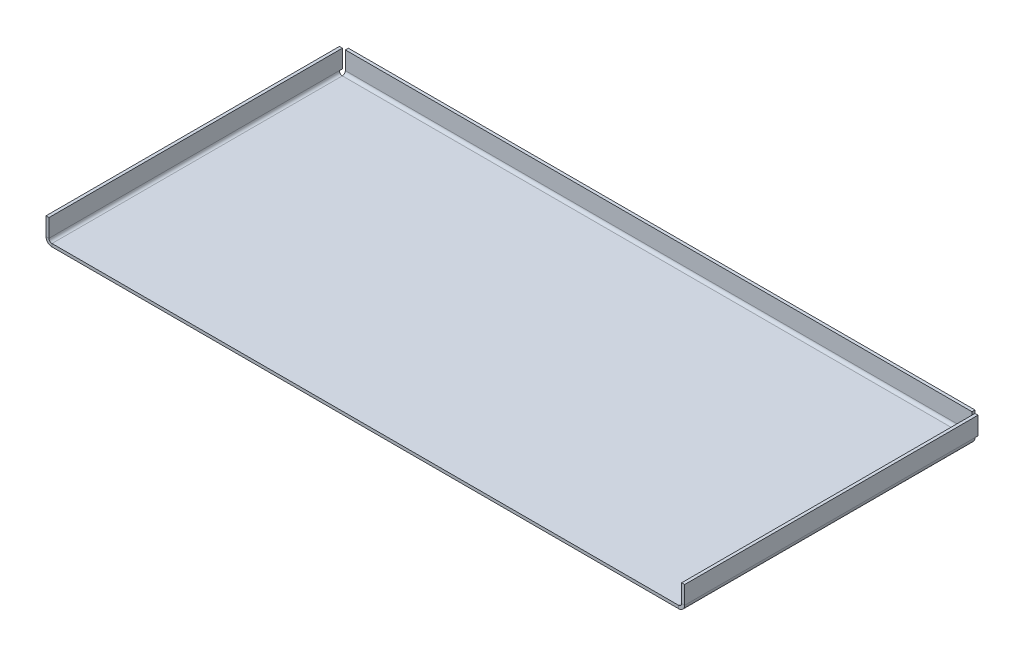
from build123d import *

# Parameters (mm, degrees)
SKETCH1_W                      = 676.28516
SKETCH1_H                      = 310.642
BASE_FLANGE1_DEPTH             = 3.175
EDGE_FLANGE2_STRIP_W           = 19.05
EDGE_FLANGE2_STRIP_H           = 3.175
EDGE_FLANGE2_STRIP_CUT_DEPTH   = 310.642
EDGE_FLANGE2_STRIP_2_W         = 19.05
EDGE_FLANGE2_STRIP_2_H         = 3.175
EDGE_FLANGE2_STRIP_CUT_2_DEPTH = 310.642
EDGE_FLANGE2_DEPTH             = 310.642
EDGE_FLANGE2_BEND_DEPTH        = 310.642
EDGE_FLANGE3_DEPTH             = 676.28516
EDGE_FLANGE3_2_DEPTH           = 6.35
EDGE_FLANGE3_START             = 669.93516
EDGE_FLANGE3_3_DEPTH           = 6.35
EDGE_FLANGE3_START_2           = 6.35
EDGE_FLANGE3_4_DEPTH           = 663.58516


# Read off the part's stored shape, not the designer's step: Edge-Flange3
# Sheet-metal steps are written as plain solids
with BuildPart() as part:
    # Sketch1 → Base-Flange1 (new body)
    with BuildSketch(Plane(origin=(0, 0, 0), x_dir=(1, 0, 0), z_dir=(0, 1, 0))):
        with Locations((338.14258, 155.321)):
            Rectangle(SKETCH1_W, SKETCH1_H)
    extrude(amount=-BASE_FLANGE1_DEPTH)

    # Edge-Flange2 strip (across the edge) → Edge-Flange2 strip cut (cut)
    with BuildSketch(Plane(origin=(676.28516, 0, 0), x_dir=(-1, 0, 0), z_dir=(0, 0, -1))):
        with Locations((-3.175, -1.5875)):
            Rectangle(EDGE_FLANGE2_STRIP_W, EDGE_FLANGE2_STRIP_H)
    extrude(amount=EDGE_FLANGE2_STRIP_CUT_DEPTH, mode=Mode.SUBTRACT)

    # Edge-Flange2 strip 2 (across the edge) → Edge-Flange2 strip cut 2 (cut)
    with BuildSketch(Plane.XY.offset(-310.642)):
        with Locations((-3.175, -1.5875)):
            Rectangle(EDGE_FLANGE2_STRIP_2_W, EDGE_FLANGE2_STRIP_2_H)
    extrude(amount=EDGE_FLANGE2_STRIP_CUT_2_DEPTH, mode=Mode.SUBTRACT)

    # Edge-Flange2 section (across the edge) → Edge-Flange2 (add)
    with BuildSketch(Plane(origin=(676.28516, 0, 0), x_dir=(-1, 0, 0), z_dir=(0, 0, -1))):
        with BuildLine():
            Line((0, 3.175), (0, 22.225))
            Line((0, 22.225), (3.175, 22.225))
            Line((3.175, 22.225), (3.175, 3.175))
            ThreePointArc((3.175, 3.175), (4.10493597, 0.92993597), (6.35, 0))
            Line((6.35, 0), (6.35, -3.175))
            ThreePointArc((6.35, -3.175), (1.859871939, -1.315128061), (0, 3.175))
        make_face()
    extrude(amount=EDGE_FLANGE2_DEPTH)

    # Edge-Flange2 section 2 (across the edge) → Edge-Flange2 bend (add)
    with BuildSketch(Plane.XY.offset(-310.642)):
        with BuildLine():
            Line((0, 3.175), (0, 22.225))
            Line((0, 22.225), (3.175, 22.225))
            Line((3.175, 22.225), (3.175, 3.175))
            ThreePointArc((3.175, 3.175), (4.10493597, 0.92993597), (6.35, 0))
            Line((6.35, 0), (6.35, -3.175))
            ThreePointArc((6.35, -3.175), (1.859871939, -1.315128061), (0, 3.175))
        make_face()
    extrude(amount=EDGE_FLANGE2_BEND_DEPTH)

    # Edge-Flange3 outline → Edge-Flange3 (cut)
    with BuildSketch(Plane.YZ):
        with BuildLine():
            Line((3.175, -310.642), (3.175, -307.467))
            Line((3.175, -307.467), (0, -307.467))
            ThreePointArc((0, -307.467), (0.92993597, -309.71206403), (3.175, -310.642))
        make_face()
        with BuildLine():
            ThreePointArc((-2.324261315, -310.642), (-2.958628997, -309.110500936), (-3.175, -307.467))
            Line((-3.175, -307.467), (-3.175, -310.642))
            Line((-3.175, -310.642), (-2.324261315, -310.642))
        make_face()
    extrude(amount=EDGE_FLANGE3_DEPTH, mode=Mode.SUBTRACT)

    # Edge-Flange3 2 outline → Edge-Flange3 2 (cut)
    with BuildSketch(Plane.YZ):
        with BuildLine():
            ThreePointArc((3.175, -310.642), (0.92993597, -309.71206403), (0, -307.467))
            Line((0, -307.467), (-3.175, -307.467))
            ThreePointArc((-3.175, -307.467), (-2.958628997, -309.110500936), (-2.324261315, -310.642))
            Line((-2.324261315, -310.642), (3.175, -310.642))
        make_face()
    extrude(amount=EDGE_FLANGE3_2_DEPTH, mode=Mode.SUBTRACT)

    # Edge-Flange3 3 outline → Edge-Flange3 3 (cut)
    with BuildSketch(Plane.YZ.offset(EDGE_FLANGE3_START)):
        with BuildLine():
            ThreePointArc((3.175, -310.642), (0.92993597, -309.71206403), (0, -307.467))
            Line((0, -307.467), (-3.175, -307.467))
            ThreePointArc((-3.175, -307.467), (-2.958628997, -309.110500936), (-2.324261315, -310.642))
            Line((-2.324261315, -310.642), (3.175, -310.642))
        make_face()
    extrude(amount=EDGE_FLANGE3_3_DEPTH, mode=Mode.SUBTRACT)

    # Edge-Flange3 4 outline → Edge-Flange3 4 (add)
    with BuildSketch(Plane.YZ.offset(EDGE_FLANGE3_START_2)):
        with BuildLine():
            Line((0, -307.467), (0, -310.642))
            Line((0, -310.642), (-2.324261315, -310.642))
            ThreePointArc((-2.324261315, -310.642), (-1e-09, -312.966261314), (3.175, -313.817))
            Line((3.175, -313.817), (22.225, -313.817))
            Line((22.225, -313.817), (22.225, -310.642))
            Line((22.225, -310.642), (3.175, -310.642))
            ThreePointArc((3.175, -310.642), (0.92993597, -309.71206403), (0, -307.467))
        make_face()
    extrude(amount=EDGE_FLANGE3_4_DEPTH)


solid = part.part
